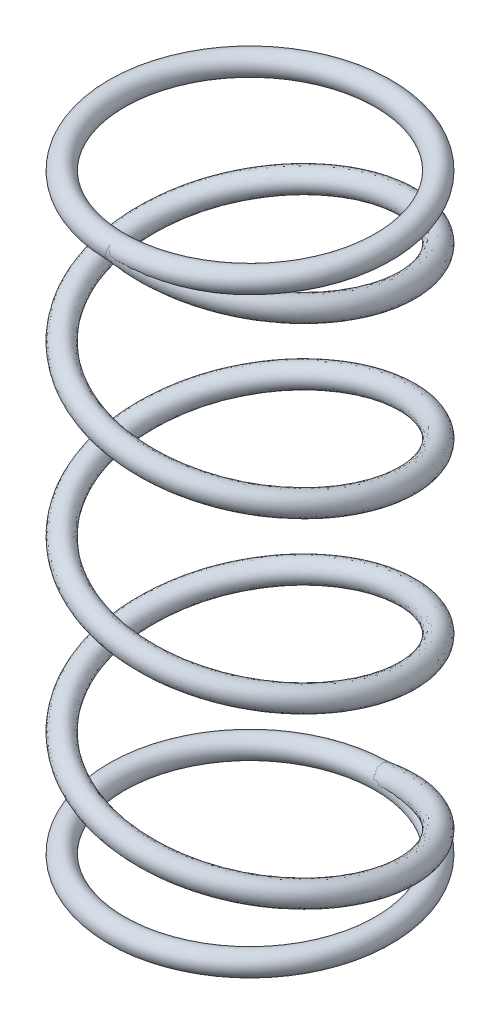
from build123d import *

# Parameters (mm, degrees)
SWEEP1_PITCH       = 5.714285714
SWEEP1_HEIGHT      = 20
SWEEP1_RADIUS      = 4.5
SWEEP1_START_ANGLE = -180
SKETCH7_R          = 0.375
SKETCH26_R         = 0.375
SKETCH28_R         = 0.375


with BuildPart() as part:
    # Sweep1: sweep along a helix
    with BuildLine() as sweep1_path:
        add(Helix(SWEEP1_PITCH, SWEEP1_HEIGHT, SWEEP1_RADIUS, center=(0, 0, 0), direction=(0, 1, 0), lefthand=True, mode=Mode.PRIVATE).rotate(Axis((0, 0, 0), (0, 1, 0)), SWEEP1_START_ANGLE))
    # Sketch7 → Sweep1 (sweep)
    with BuildSketch(Plane(origin=(0, 0, -4.5), x_dir=(0, 0, -1), z_dir=(0.9801825468403425, 0.1980963777295789, -7.261225428015031e-15))):
        Circle(SKETCH7_R)
    sweep(path=sweep1_path.line, is_frenet=True)


with BuildPart() as body_2:
    # Sweep16: sweep along a path in Sketch25
    with BuildLine(Plane(origin=(0, 0, 0), x_dir=(1, 0, 0), z_dir=(0, 1, 0))) as sweep16_path:
        CenterArc((0, 0), 4.5, 0, 360)
    # Sketch26 → Sweep16 (sweep)
    with BuildSketch(Plane.XY):
        with Locations((-4.5, 0)):
            Circle(SKETCH26_R)
    sweep(path=sweep16_path.line)


with BuildPart() as body_3:
    # Sweep18: sweep along a path in Sketch27
    with BuildLine(Plane(origin=(0, 20, 0), x_dir=(1, 0, 0), z_dir=(0, 1, 0))) as sweep18_path:
        CenterArc((0, 0), 4.5, 0, 360)
    # Sketch28 → Sweep18 (sweep)
    with BuildSketch(Plane.XY):
        with Locations((-4.5, 20)):
            Circle(SKETCH28_R)
    sweep(path=sweep18_path.line)


solid = Compound([part.part, body_2.part, body_3.part])
